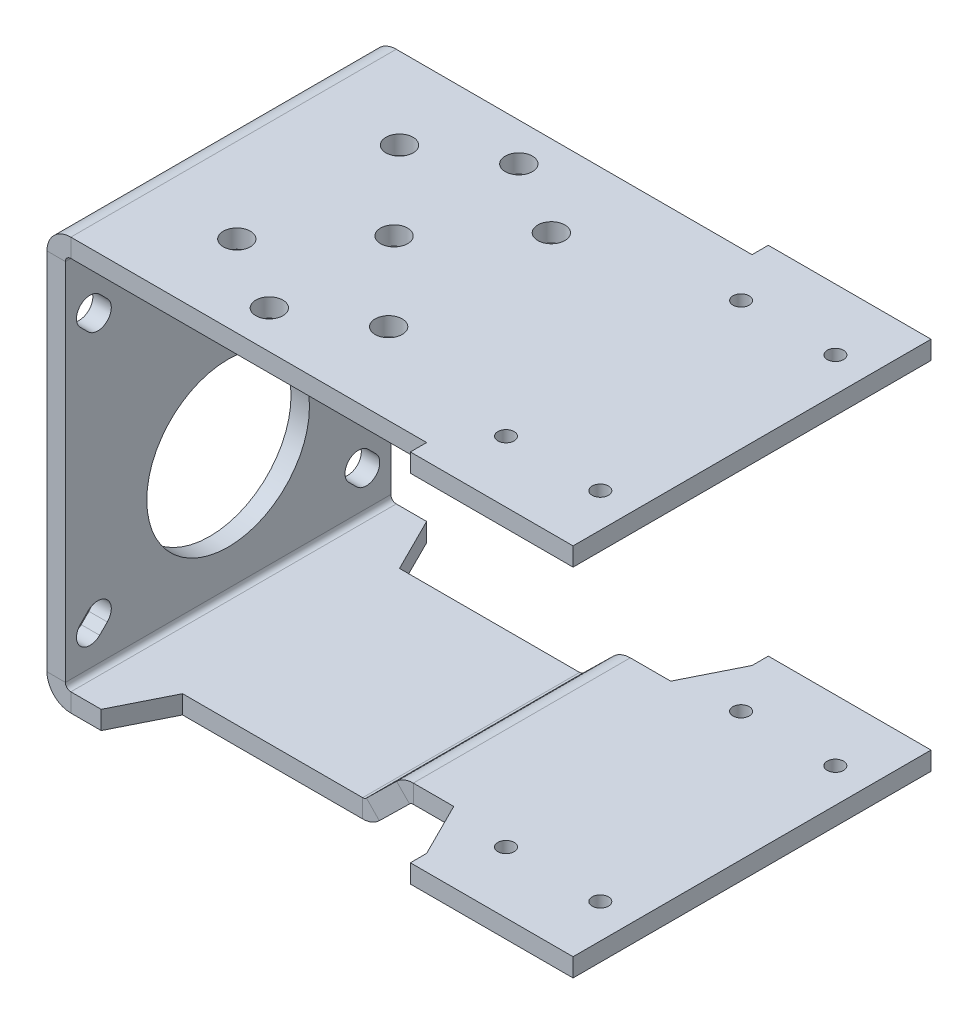
from build123d import *

# Parameters (mm, degrees)
BASE_FLANGE1_DEPTH             = 60
SKETCH6_R                      = 15
CUT_EXTRUDE1_DEPTH             = 3.4
CUT_EXTRUDE2_START             = -65
CUT_EXTRUDE2_OUTLINE_W         = 10
CUT_EXTRUDE2_OUTLINE_H         = 10.4
CUT_EXTRUDE2_DEPTH             = 50
SKETCH10_W                     = 3
SKETCH10_H                     = 3.4
BOSS_EXTRUDE1_DEPTH            = 30
MIRROR2_COPY_1_SKETCH_W        = 3
MIRROR2_COPY_1_SKETCH_H        = 3.4
MIRROR2_COPY_1_DEPTH           = 30
SKETCH13_R                     = 1.5
CUT_EXTRUDE3_DEPTH             = 141.516902898
CUT_EXTRUDE6_REACH             = 142.517
SKETCH14_R                     = 2.5
CUT_EXTRUDE7_DEPTH             = 5
CUT_EXTRUDE7_DIRECTION_2_REACH = 138.858


# Read off the part's stored shape, not the designer's step: Cut-Extrude2
# Sheet-metal steps are written as plain solids
with BuildPart() as part:
    # Sketch1 → Base-Flange1 (new body)
    with BuildSketch(Plane.XY):
        with BuildLine():
            Line((100, 0), (4.4, 0))
            ThreePointArc((4.4, 0), (1.288730163, -1.288730163), (0, -4.4))
            Line((0, -4.4), (0, -71.6))
            ThreePointArc((0, -71.6), (1.288730163, -74.711269837), (4.4, -76))
            Line((4.4, -76), (48.203183584, -76))
            ThreePointArc((48.203183584, -76), (49.866643015, -75.673438685), (51.283183584, -74.742228509))
            Line((51.283183584, -74.742228509), (56.849795796, -69.285857157))
            ThreePointArc((56.849795796, -69.285857157), (57.171736834, -69.074218481), (57.549795796, -69))
            Line((57.549795796, -69), (100, -69))
            Line((100, -69), (100, -65.6))
            Line((100, -65.6), (57.549795796, -65.6))
            ThreePointArc((57.549795796, -65.6), (55.886336364, -65.926561315), (54.469795796, -66.857771491))
            Line((54.469795796, -66.857771491), (48.903183584, -72.314142843))
            ThreePointArc((48.903183584, -72.314142843), (48.581242545, -72.525781519), (48.203183584, -72.6))
            Line((48.203183584, -72.6), (4.4, -72.6))
            ThreePointArc((4.4, -72.6), (3.692893219, -72.307106781), (3.4, -71.6))
            Line((3.4, -71.6), (3.4, -4.4))
            ThreePointArc((3.4, -4.4), (3.692893219, -3.692893219), (4.4, -3.4))
            Line((4.4, -3.4), (100, -3.4))
            Line((100, -3.4), (100, 0))
        make_face()
    extrude(amount=BASE_FLANGE1_DEPTH)

    # Sketch6 → Cut-Extrude1 (cut)
    with BuildSketch(Plane.ZY):
        with Locations(Location((30, -50, 0), (0, 0, 270))):
            Circle(SKETCH6_R)
        with BuildLine():
            Line((57.224873734, -63.689339828), (55.810660172, -62.275126266))
            ThreePointArc((55.810660172, -62.275126266), (52.275126266, -62.275126266), (52.275126266, -65.810660172))
            Line((52.275126266, -65.810660172), (53.689339828, -67.224873734))
            ThreePointArc((53.689339828, -67.224873734), (57.224873734, -67.224873734), (57.224873734, -63.689339828))
        make_face()
        with BuildLine():
            Line((2.775126266, -16.310660172), (4.189339828, -17.724873734))
            ThreePointArc((4.189339828, -17.724873734), (7.724873734, -17.724873734), (7.724873734, -14.189339828))
            Line((7.724873734, -14.189339828), (6.310660172, -12.775126266))
            ThreePointArc((6.310660172, -12.775126266), (2.775126266, -12.775126266), (2.775126266, -16.310660172))
        make_face()
        with BuildLine():
            Line((53.689339828, -12.775126266), (52.275126266, -14.189339828))
            ThreePointArc((52.275126266, -14.189339828), (52.275126266, -17.724873734), (55.810660172, -17.724873734))
            Line((55.810660172, -17.724873734), (57.224873734, -16.310660172))
            ThreePointArc((57.224873734, -16.310660172), (57.224873734, -12.775126266), (53.689339828, -12.775126266))
        make_face()
        with BuildLine():
            Line((6.310660172, -67.224873734), (7.724873734, -65.810660172))
            ThreePointArc((7.724873734, -65.810660172), (7.724873734, -62.275126266), (4.189339828, -62.275126266))
            Line((4.189339828, -62.275126266), (2.775126266, -63.689339828))
            ThreePointArc((2.775126266, -63.689339828), (2.775126266, -67.224873734), (6.310660172, -67.224873734))
        make_face()
    extrude(amount=-CUT_EXTRUDE1_DEPTH, mode=Mode.SUBTRACT)

    # Cut-Extrude2 outline → Cut-Extrude2 (cut)
    with BuildSketch(Plane.ZY.offset(CUT_EXTRUDE2_START)):
        with Locations((55, -70.8)):
            Rectangle(CUT_EXTRUDE2_OUTLINE_W, CUT_EXTRUDE2_OUTLINE_H)
        with Locations((5, -70.8)):
            Rectangle(CUT_EXTRUDE2_OUTLINE_W, CUT_EXTRUDE2_OUTLINE_H)
    extrude(amount=CUT_EXTRUDE2_DEPTH, mode=Mode.SUBTRACT)

    # Sketch10 → Boss-Extrude1 (add)
    with BuildSketch(Plane(origin=(100, 0, 0), x_dir=(0, 0, -1), z_dir=(1, 0, 0))):
        with Locations((1.5, -1.7)):
            Rectangle(SKETCH10_W, SKETCH10_H)
    boss_extrude1 = extrude(amount=-BOSS_EXTRUDE1_DEPTH)

    # Mirror1: Boss-Extrude1 across plane
    add(boss_extrude1.mirror(Plane(origin=(0, 0, 30), x_dir=(1, 0, 0), z_dir=(0, 0, -1))))

    # Mirror2: Boss-Extrude1 across plane
    add(boss_extrude1.mirror(Plane(origin=(0, -34.5, 0), x_dir=(0, 0, 1), z_dir=(0, -1, 0))))

    # Mirror2 copy 1 sketch → Mirror2 copy 1 (add)
    with BuildSketch(Plane(origin=(100, -69, 60), x_dir=(0, 0, 1), z_dir=(1, 0, 0))):
        with Locations((1.5, -1.7)):
            Rectangle(MIRROR2_COPY_1_SKETCH_W, MIRROR2_COPY_1_SKETCH_H)
    extrude(amount=-MIRROR2_COPY_1_DEPTH)

    # Sketch13 → Cut-Extrude3 (cut, through all)
    with BuildSketch(Plane(origin=(0, 0, 0), x_dir=(1, 0, 0), z_dir=(0, 1, 0))):
        with Locations(Location((76.306667563, -8.329371406, 0), (0, 0, 270))):
            Circle(SKETCH13_R)
        with Locations(Location((93.693332437, -8.329371406, 0), (0, 0, 270))):
            Circle(SKETCH13_R)
    cut_extrude3 = extrude(amount=-CUT_EXTRUDE3_DEPTH, mode=Mode.SUBTRACT)

    # Mirror3: Cut-Extrude3 across plane
    add(cut_extrude3.mirror(Plane(origin=(0, 0, 30), x_dir=(1, 0, 0), z_dir=(0, 0, -1))), mode=Mode.SUBTRACT)

    # Sketch14 → Cut-Extrude6 (cut, up to next)
    with BuildSketch(Plane(origin=(0, 0, 0), x_dir=(1, 0, 0), z_dir=(0, 1, 0)), mode=Mode.PRIVATE) as cut_extrude6_sk1:
        with Locations(Location((20, -15, 0), (0, 0, 270))):
            Circle(SKETCH14_R)
    cut_extrude6_tool1 = extrude(cut_extrude6_sk1.sketch, amount=-CUT_EXTRUDE6_REACH, mode=Mode.PRIVATE) & part.part
    # Sketch14 → Cut-Extrude6 (cut, up to next)
    with BuildSketch(Plane(origin=(0, 0, 0), x_dir=(1, 0, 0), z_dir=(0, 1, 0)), mode=Mode.PRIVATE) as cut_extrude6_sk2:
        with Locations(Location((48, -15, 0), (0, 0, 270))):
            Circle(SKETCH14_R)
    cut_extrude6_tool2 = extrude(cut_extrude6_sk2.sketch, amount=-CUT_EXTRUDE6_REACH, mode=Mode.PRIVATE) & part.part
    # Sketch14 → Cut-Extrude6 (cut, up to next)
    with BuildSketch(Plane(origin=(0, 0, 0), x_dir=(1, 0, 0), z_dir=(0, 1, 0)), mode=Mode.PRIVATE) as cut_extrude6_sk3:
        with Locations(Location((48, -45, 0), (0, 0, 270))):
            Circle(SKETCH14_R)
    cut_extrude6_tool3 = extrude(cut_extrude6_sk3.sketch, amount=-CUT_EXTRUDE6_REACH, mode=Mode.PRIVATE) & part.part
    # Sketch14 → Cut-Extrude6 (cut, up to next)
    with BuildSketch(Plane(origin=(0, 0, 0), x_dir=(1, 0, 0), z_dir=(0, 1, 0)), mode=Mode.PRIVATE) as cut_extrude6_sk4:
        with Locations(Location((20, -45, 0), (0, 0, 270))):
            Circle(SKETCH14_R)
    cut_extrude6_tool4 = extrude(cut_extrude6_sk4.sketch, amount=-CUT_EXTRUDE6_REACH, mode=Mode.PRIVATE) & part.part
    # Sketch14 → Cut-Extrude6 (cut, up to next)
    with BuildSketch(Plane(origin=(0, 0, 0), x_dir=(1, 0, 0), z_dir=(0, 1, 0)), mode=Mode.PRIVATE) as cut_extrude6_sk5:
        with Locations(Location((34, -30, 0), (0, 0, 270))):
            Circle(SKETCH14_R)
    cut_extrude6_tool5 = extrude(cut_extrude6_sk5.sketch, amount=-CUT_EXTRUDE6_REACH, mode=Mode.PRIVATE) & part.part
    # Sketch14 → Cut-Extrude6 (cut, up to next)
    with BuildSketch(Plane(origin=(0, 0, 0), x_dir=(1, 0, 0), z_dir=(0, 1, 0)), mode=Mode.PRIVATE) as cut_extrude6_sk6:
        with Locations(Location((34, -7, 0), (0, 0, 270))):
            Circle(SKETCH14_R)
    cut_extrude6_tool6 = extrude(cut_extrude6_sk6.sketch, amount=-CUT_EXTRUDE6_REACH, mode=Mode.PRIVATE) & part.part
    # Sketch14 → Cut-Extrude6 (cut, up to next)
    with BuildSketch(Plane(origin=(0, 0, 0), x_dir=(1, 0, 0), z_dir=(0, 1, 0)), mode=Mode.PRIVATE) as cut_extrude6_sk7:
        with Locations(Location((34, -53, 0), (0, 0, 270))):
            Circle(SKETCH14_R)
    cut_extrude6_tool7 = extrude(cut_extrude6_sk7.sketch, amount=-CUT_EXTRUDE6_REACH, mode=Mode.PRIVATE) & part.part
    add(cut_extrude6_tool1.solids().sort_by_distance((20, 0, 15))[0], mode=Mode.SUBTRACT)
    add(cut_extrude6_tool2.solids().sort_by_distance((48, 0, 15))[0], mode=Mode.SUBTRACT)
    add(cut_extrude6_tool3.solids().sort_by_distance((48, 0, 45))[0], mode=Mode.SUBTRACT)
    add(cut_extrude6_tool4.solids().sort_by_distance((20, 0, 45))[0], mode=Mode.SUBTRACT)
    add(cut_extrude6_tool5.solids().sort_by_distance((34, 0, 30))[0], mode=Mode.SUBTRACT)
    add(cut_extrude6_tool6.solids().sort_by_distance((34, 0, 7))[0], mode=Mode.SUBTRACT)
    add(cut_extrude6_tool7.solids().sort_by_distance((34, 0, 53))[0], mode=Mode.SUBTRACT)

    # Sketch15 → Cut-Extrude7 (cut)
    with BuildSketch(Plane.XZ.offset(69)):
        Polygon((65, 50), (70, 60), (65, 60), align=None)
        Polygon((15, 50), (15, 60), (10, 60), align=None)
    cut_extrude7 = extrude(amount=-CUT_EXTRUDE7_DEPTH, mode=Mode.SUBTRACT)

    # Cut-Extrude7 direction 2: up to this face of the body (flat: up to its plane)
    cut_extrude7_direction_2_end = Plane(part.part.faces().sort_by_distance((24.509682794, -76, 30))[0])
    # Sketch15 → Cut-Extrude7 direction 2 (cut, up to the picked face)
    with BuildSketch(Plane.XZ.offset(69), mode=Mode.PRIVATE) as cut_extrude7_direction_2_sk1:
        Polygon((65, 50), (70, 60), (65, 60), align=None)
    cut_extrude7_direction_2_tool1 = split(extrude(cut_extrude7_direction_2_sk1.sketch, amount=CUT_EXTRUDE7_DIRECTION_2_REACH, mode=Mode.PRIVATE), bisect_by=cut_extrude7_direction_2_end, keep=Keep.BOTH, mode=Mode.PRIVATE)
    # Sketch15 → Cut-Extrude7 direction 2 (cut, up to the picked face)
    with BuildSketch(Plane.XZ.offset(69), mode=Mode.PRIVATE) as cut_extrude7_direction_2_sk2:
        Polygon((15, 50), (15, 60), (10, 60), align=None)
    cut_extrude7_direction_2_tool2 = split(extrude(cut_extrude7_direction_2_sk2.sketch, amount=CUT_EXTRUDE7_DIRECTION_2_REACH, mode=Mode.PRIVATE), bisect_by=cut_extrude7_direction_2_end, keep=Keep.BOTH, mode=Mode.PRIVATE)
    cut_extrude7_direction_2_1 = cut_extrude7_direction_2_tool1.solids().sort_by(Axis((66.666667, -69, 56.666667), (0, -1, 0)))[0]
    add(cut_extrude7_direction_2_1, mode=Mode.SUBTRACT)
    cut_extrude7_direction_2_2 = cut_extrude7_direction_2_tool2.solids().sort_by(Axis((13.333333, -69, 56.666667), (0, -1, 0)))[0]
    add(cut_extrude7_direction_2_2, mode=Mode.SUBTRACT)
    cut_extrude7_direction_2 = cut_extrude7_direction_2_1 + cut_extrude7_direction_2_2  # Cut-Extrude7 direction 2 as one shape, for the pattern or mirror that repeats it

    # Mirror4: Cut-Extrude7, Cut-Extrude7 direction 2 across plane
    add(cut_extrude7.mirror(Plane(origin=(0, 0, 30), x_dir=(1, 0, 0), z_dir=(0, 0, -1))), mode=Mode.SUBTRACT)
    add(cut_extrude7_direction_2.mirror(Plane(origin=(0, 0, 30), x_dir=(1, 0, 0), z_dir=(0, 0, -1))), mode=Mode.SUBTRACT)


solid = part.part
